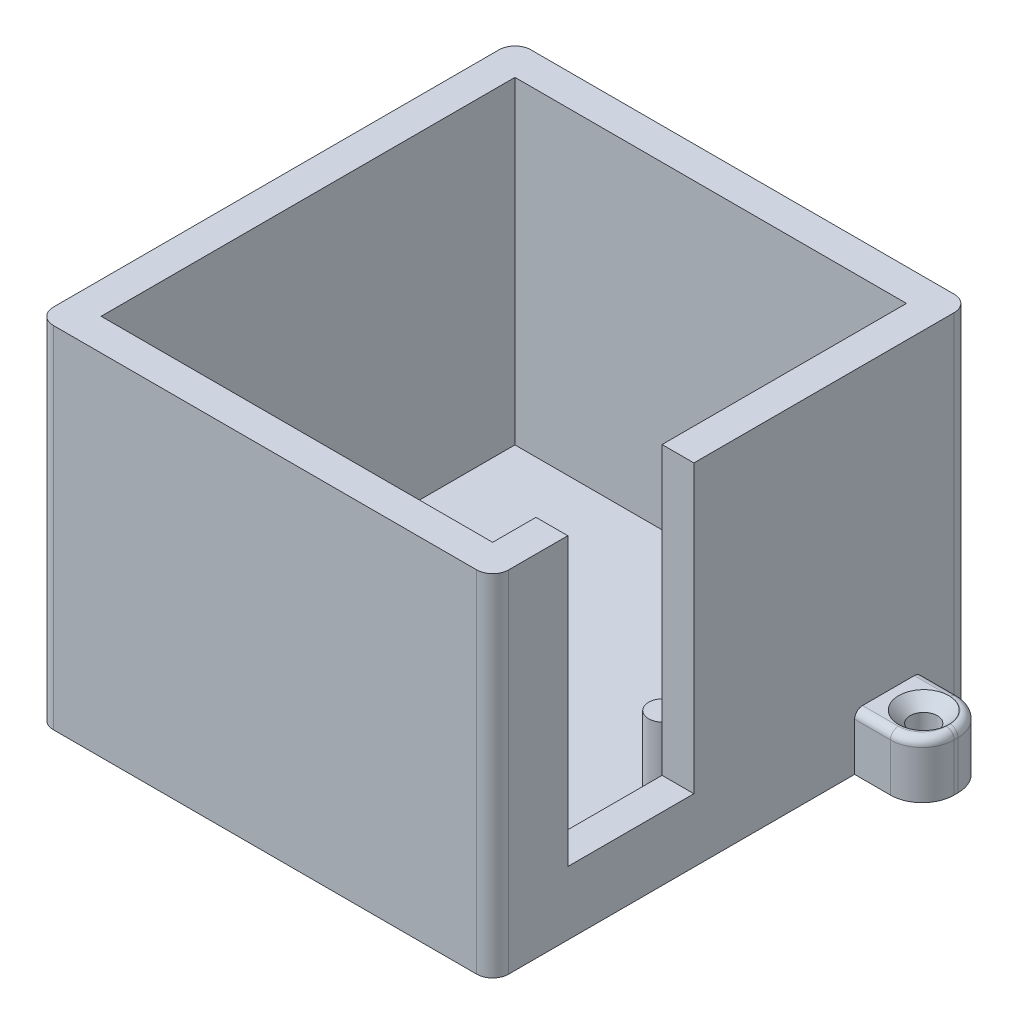
from build123d import *

# Parameters (mm, degrees)
ESQUISSE1_W                                    = 49.2
ESQUISSE1_H                                    = 52
BOSS_EXTRU_1_DEPTH                             = 40
COQUE1_T                                       = 4
CONG_1_R                                       = 2
CONG_2_R                                       = 2
CONG_3_R                                       = 2
CONG_4_R                                       = 2
ESQUISSE5_R                                    = 1.8
BOSS_EXTRU_2_DEPTH                             = 9
ESQUISSE9_W                                    = 4
ESQUISSE9_H                                    = 15.843796137
ENL_V_MAT_EXTRU_3_DEPTH                        = 36
ESQUISSE11_W                                   = 8.5
ESQUISSE11_H                                   = 8.5
BOSS_EXTRU_4_DEPTH                             = 7
CONG_5_R                                       = 4
CONG_6_R                                       = 4
CONG_7_R                                       = 1
CONG_8_R                                       = 1
FRAISAGE_POUR_VIS_T_TE_FRAIS_E_M31_D           = 3.4
FRAISAGE_POUR_VIS_T_TE_FRAIS_E_M31_CSINK_D     = 6.3
FRAISAGE_POUR_VIS_T_TE_FRAIS_E_M31_CSINK_ANGLE = 90


with BuildPart() as part:
    # Esquisse1 → Boss.-Extru.1 (new body)
    with BuildSketch(Plane(origin=(0, 0, 0), x_dir=(1, 0, 0), z_dir=(0, 1, 0))):
        Rectangle(ESQUISSE1_W, ESQUISSE1_H)
    extrude(amount=BOSS_EXTRU_1_DEPTH)

    # Coque1
    coque1_openings = [part.faces().sort_by_distance(p)[0] for p in [
        (0, 40, 0),
    ]]
    offset(amount=COQUE1_T, openings=coque1_openings, kind=Kind.INTERSECTION)

    # Congé1
    # the kernel refuses this fillet: 2 mm, written as the material it takes off along each edge
    with BuildSketch(Plane(origin=(28.6, -9, 30), x_dir=(-1, 0, 0), z_dir=(0, 1, 0))) as cong_1_piece_1:
        with BuildLine():
            CenterArc((CONG_1_R, -CONG_1_R), CONG_1_R, 90, 90)
            Line((0, -CONG_1_R), (0, 0))
            Line((0, 0), (CONG_1_R, 0))
        make_face()
    extrude(amount=54, mode=Mode.SUBTRACT)

    # Congé2
    cong_2_edges = [part.edges().sort_by_distance(p)[0] for p in [
        (28.6, 18, -30),
    ]]
    fillet(cong_2_edges, radius=CONG_2_R)

    # Congé3
    cong_3_edges = [part.edges().sort_by_distance(p)[0] for p in [
        (-28.6, 18, -30),
    ]]
    fillet(cong_3_edges, radius=CONG_3_R)

    # Congé4
    cong_4_edges = [part.edges().sort_by_distance(p)[0] for p in [
        (-28.6, 18, 30),
    ]]
    fillet(cong_4_edges, radius=CONG_4_R)

    # Esquisse5 → Boss.-Extru.2 (add)
    with BuildSketch(Plane(origin=(0, 0, 0), x_dir=(1, 0, 0), z_dir=(0, 1, 0))):
        with Locations(Location((-22.6, -2.6, 0), (0, 0, 90))):
            Circle(ESQUISSE5_R)
        with Locations(Location((22.6, -2.6, 0), (0, 0, 90))):
            Circle(ESQUISSE5_R)
        with Locations(Location((-22.6, -24, 0), (0, 0, 90))):
            Circle(ESQUISSE5_R)
        with Locations(Location((22.6, -24, 0), (0, 0, 90))):
            Circle(ESQUISSE5_R)
    extrude(amount=BOSS_EXTRU_2_DEPTH)

    # Esquisse9 → Enlèv. mat.-Extru.3 (cut)
    with BuildSketch(Plane(origin=(0, 40, 0), x_dir=(1, 0, 0), z_dir=(0, 1, 0))):
        with Locations((26.6, -12.636910853)):
            Rectangle(ESQUISSE9_W, ESQUISSE9_H)
    extrude(amount=-ENL_V_MAT_EXTRU_3_DEPTH, mode=Mode.SUBTRACT)

    # Esquisse11 → Boss.-Extru.4 (add)
    with BuildSketch(Plane(origin=(0, -4, 0), x_dir=(-1, 0, 0), z_dir=(0, -1, 0))):
        with Locations((32.85, 19.732237021)):
            Rectangle(ESQUISSE11_W, ESQUISSE11_H)
        with Locations((-32.85, 19.732237021)):
            Rectangle(ESQUISSE11_W, ESQUISSE11_H)
    extrude(amount=-BOSS_EXTRU_4_DEPTH)

    # Congé5
    cong_5_edges = [part.edges().sort_by_distance(p)[0] for p in [
        (37.1, -0.5, -15.482237021),
        (37.1, -0.5, -23.982237021),
    ]]
    fillet(cong_5_edges, radius=CONG_5_R)

    # Congé6
    cong_6_edges = [part.edges().sort_by_distance(p)[0] for p in [
        (-37.1, -0.5, -23.982237021),
        (-37.1, -0.5, -15.482237021),
    ]]
    fillet(cong_6_edges, radius=CONG_6_R)

    # Congé7
    cong_7_edges = [part.edges().sort_by_distance(p)[0] for p in [
        (-37.1, 3, -19.732237021),
        (-30.85, 3, -23.982237021),
        (-35.928427125, 3, -16.653809897),
        (-35.928427125, 3, -22.810664146),
        (-30.85, 3, -15.482237021),
    ]]
    fillet(cong_7_edges, radius=CONG_7_R)

    # Congé8
    cong_8_edges = [part.edges().sort_by_distance(p)[0] for p in [
        (37.1, 3, -19.732237021),
        (30.85, 3, -15.482237021),
        (35.928427125, 3, -22.810664146),
        (35.928427125, 3, -16.653809897),
        (30.85, 3, -23.982237021),
    ]]
    fillet(cong_8_edges, radius=CONG_8_R)

    # Fraisage pour vis à tête fraisée M31 (through all)
    with Locations(Plane(origin=(0, 3, 0), x_dir=(1, 0, 0), z_dir=(0, 1, 0))):
        with Locations((-32.904561285, 19.825700849), (32.940796686, 19.825700849)):
            CounterSinkHole(FRAISAGE_POUR_VIS_T_TE_FRAIS_E_M31_D / 2, FRAISAGE_POUR_VIS_T_TE_FRAIS_E_M31_CSINK_D / 2, counter_sink_angle=FRAISAGE_POUR_VIS_T_TE_FRAIS_E_M31_CSINK_ANGLE)


solid = part.part
